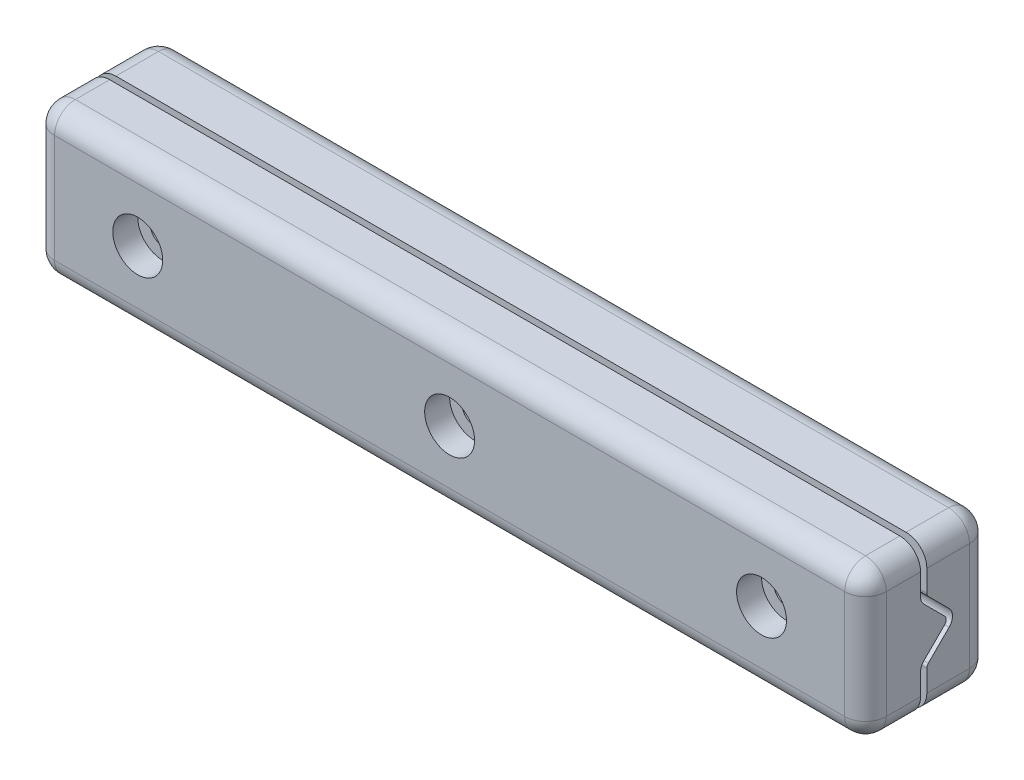
from build123d import *

# Parameters (mm, degrees)
SKETCH_1_W          = 200
SKETCH_1_H          = 36
EXTRUDE_1_DEPTH     = 15
FILLET_1_R          = 5
CUT_EXTRUDE_8_DEPTH = 202.444781516
SKETCH_4_R          = 3
CUT_EXTRUDE_4_DEPTH = 505.215231821
SKETCH_7_R          = 6
CUT_EXTRUDE_5_DEPTH = 6
SKETCH_8_R          = 6
CUT_EXTRUDE_6_DEPTH = 6


with BuildPart() as part:
    # Эскиз1 → Бобышка-Вытянуть1 (new, symmetric)
    with BuildSketch(Plane.XY.offset(-1)):
        with Locations((403, 0)):
            Rectangle(SKETCH_1_W, SKETCH_1_H)
    extrude(amount=EXTRUDE_1_DEPTH, both=True)

    # Скругление1
    fillet_1_edges = [part.edges().sort_by_distance(p)[0] for p in [
        (403, -18, -16),
        (303, -18, -1),
        (303, 0, -16),
        (503, -18, -1),
        (503, 0, -16),
        (403, -18, 14),
        (303, 0, 14),
        (503, 0, 14),
        (503, 18, -1),
        (403, 18, 14),
        (303, 18, -1),
        (403, 18, -16),
    ]]
    fillet(fillet_1_edges, radius=FILLET_1_R)

    # Эскиз3 → Вырез-Вытянуть8 (cut, through all)
    with BuildSketch(Plane(origin=(503, 0, 0), x_dir=(0, 0, -1), z_dir=(1, 0, 0))):
        with BuildLine():
            Line((0.055456352, 5.883883476), (5.055456352, 0.883883476))
            ThreePointArc((5.055456352, 0.883883476), (5.421572875, 0), (5.055456352, -0.883883476))
            Line((5.055456352, -0.883883476), (0.055456352, -5.883883476))
            ThreePointArc((0.055456352, -5.883883476), (-0.540668714, -6.776047686), (-0.75, -7.828427125))
            Line((-0.75, -7.828427125), (-0.75, -19.290089193))
            Line((-0.75, -19.290089193), (0.75, -19.290089193))
            Line((0.75, -19.290089193), (0.75, -7.828427125))
            ThreePointArc((0.75, -7.828427125), (0.845150584, -7.350072834), (1.116116524, -6.944543648))
            Line((1.116116524, -6.944543648), (6.116116524, -1.944543648))
            ThreePointArc((6.116116524, -1.944543648), (6.921572875, 0), (6.116116524, 1.944543648))
            Line((6.116116524, 1.944543648), (1.116116524, 6.944543648))
            ThreePointArc((1.116116524, 6.944543648), (0.845150584, 7.350072834), (0.75, 7.828427125))
            Line((0.75, 7.828427125), (0.75, 19.774069925))
            Line((0.75, 19.774069925), (-0.75, 19.774069925))
            Line((-0.75, 19.774069925), (-0.75, 7.828427125))
            ThreePointArc((-0.75, 7.828427125), (-0.540668714, 6.776047686), (0.055456352, 5.883883476))
        make_face()
    extrude(amount=-CUT_EXTRUDE_8_DEPTH, mode=Mode.SUBTRACT)


with BuildPart() as cut_extrude_8_piece_1:
    # of the separate pieces the step leaves, piece 1, a body of its own (cut_extrude_8_pieces)
    add(part.part.solids().sort_by_distance((308, -18, 9))[0])


with BuildPart() as cut_extrude_8_piece_2:
    # of the separate pieces the step leaves, piece 2, a body of its own (cut_extrude_8_pieces)
    add(part.part.solids().sort_by_distance((308, -18, -0.75))[0])


with BuildPart() as cut_extrude_4_tool:
    # Эскиз4 → Вырез-Вытянуть4 (new, through all)
    with BuildSketch(Plane.XY.offset(14)):
        with Locations((403, 0)):
            Circle(SKETCH_4_R)
        with Locations((328, 0)):
            Circle(SKETCH_4_R)
        with Locations((478, 0)):
            Circle(SKETCH_4_R)
    extrude(amount=-CUT_EXTRUDE_4_DEPTH)


with BuildPart() as cut_extrude_8_piece_1_1:
    add(cut_extrude_8_piece_1.part)

    # Вырез-Вытянуть4: cut by cut_extrude_4_tool
    add(cut_extrude_4_tool.part, mode=Mode.SUBTRACT)

    # Эскиз7 → Вырез-Вытянуть5 (cut)
    with BuildSketch(Plane.XY.offset(14)):
        with Locations((328, 0)):
            Circle(SKETCH_7_R)
        with Locations((403, 0)):
            Circle(SKETCH_7_R)
        with Locations((478, 0)):
            Circle(SKETCH_7_R)
    extrude(amount=-CUT_EXTRUDE_5_DEPTH, mode=Mode.SUBTRACT)


with BuildPart() as cut_extrude_8_piece_2_1:
    add(cut_extrude_8_piece_2.part)

    # Вырез-Вытянуть4: cut by cut_extrude_4_tool
    add(cut_extrude_4_tool.part, mode=Mode.SUBTRACT)

    # Эскиз8 → Вырез-Вытянуть6 (cut)
    with BuildSketch(Plane(origin=(0, 0, -16), x_dir=(-1, 0, 0), z_dir=(0, 0, -1))):
        with Locations((-328, 0)):
            Circle(SKETCH_8_R)
        with Locations((-403, 0)):
            Circle(SKETCH_8_R)
        with Locations((-478, 0)):
            Circle(SKETCH_8_R)
    extrude(amount=-CUT_EXTRUDE_6_DEPTH, mode=Mode.SUBTRACT)


solid = Compound([cut_extrude_8_piece_1_1.part, cut_extrude_8_piece_2_1.part])
